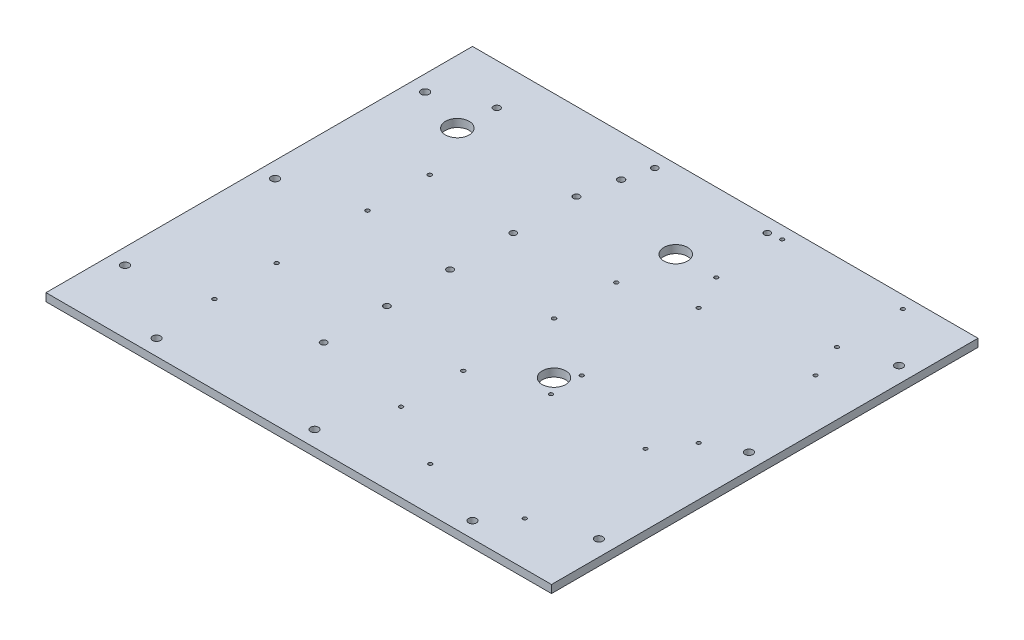
from build123d import *

# Parameters (mm, degrees)
SKETCH1_W           = 406.4
SKETCH1_H           = 342.9
BOSS_EXTRUDE1_DEPTH = 6.35
SKETCH3_R           = 3.175
CUT_EXTRUDE1_DEPTH  = 532.772218624
SKETCH4_R           = 9.525
SKETCH4_R_2         = 1.5875
SKETCH4_R_3         = 2.5
SKETCH4_R_4         = 2.667
SKETCH4_R_5         = 2.54
SKETCH4_R_6         = 1.5
CUT_EXTRUDE2_DEPTH  = 532.772218624


with BuildPart() as part:
    # Sketch1 → Boss-Extrude1 (new body)
    with BuildSketch(Plane(origin=(0, 0, 0), x_dir=(1, 0, 0), z_dir=(0, 1, 0))):
        with Locations((203.2, 171.45)):
            Rectangle(SKETCH1_W, SKETCH1_H)
    extrude(amount=BOSS_EXTRUDE1_DEPTH)

    # Sketch3 → Cut-Extrude1 (cut, through all)
    with BuildSketch(Plane(origin=(0, 6.35, 0), x_dir=(1, 0, 0), z_dir=(0, 1, 0))):
        with Locations((203.2, 12.7)):
            Circle(SKETCH3_R)
        with Locations((330.2, 12.7)):
            Circle(SKETCH3_R)
        with Locations((76.2, 12.7)):
            Circle(SKETCH3_R)
        with Locations((12.7, 171.45)):
            Circle(SKETCH3_R)
        with Locations((393.7, 171.45)):
            Circle(SKETCH3_R)
        with Locations((12.7, 292.1)):
            Circle(SKETCH3_R)
        with Locations((12.7, 50.8)):
            Circle(SKETCH3_R)
        with Locations((393.7, 50.8)):
            Circle(SKETCH3_R)
        with Locations((393.7, 292.1)):
            Circle(SKETCH3_R)
    extrude(amount=-CUT_EXTRUDE1_DEPTH, mode=Mode.SUBTRACT)

    # Sketch4 → Cut-Extrude2 (cut, through all)
    with BuildSketch(Plane(origin=(0, 6.35, 0), x_dir=(1, 0, 0), z_dir=(0, 1, 0))):
        with Locations((226.4, 279.9)):
            Circle(SKETCH4_R)
        with Locations((50.8, 279.9)):
            Circle(SKETCH4_R)
        with Locations((222.1748, 63.265)):
            Circle(SKETCH4_R_2)
        with Locations((222.1748, 113.265)):
            Circle(SKETCH4_R_2)
        with Locations((72.1748, 113.265)):
            Circle(SKETCH4_R_2)
        with Locations((72.1748, 63.265)):
            Circle(SKETCH4_R_2)
        with Locations((72.1748, 186.295)):
            Circle(SKETCH4_R_2)
        with Locations((72.1748, 236.295)):
            Circle(SKETCH4_R_2)
        with Locations((222.1748, 236.295)):
            Circle(SKETCH4_R_2)
        with Locations((222.1748, 186.295)):
            Circle(SKETCH4_R_2)
        with Locations((248.4501, 331.47)):
            Circle(SKETCH4_R_3)
        with Locations((157.9499, 331.47)):
            Circle(SKETCH4_R_3)
        with Locations((52.5398, 309.88)):
            Circle(SKETCH4_R_4)
        with Locations((152.5398, 309.88)):
            Circle(SKETCH4_R_4)
        with Locations((146.3548, 178.4985)):
            Circle(SKETCH4_R_5)
        with Locations((146.3548, 127.6985)):
            Circle(SKETCH4_R_5)
        with Locations((146.3548, 76.8985)):
            Circle(SKETCH4_R_5)
        with Locations((146.3548, 280.0985)):
            Circle(SKETCH4_R_5)
        with Locations((146.3548, 229.2985)):
            Circle(SKETCH4_R_5)
        with Locations((355.833, 333.05)):
            Circle(SKETCH4_R_6)
        with Locations((258.833, 333.05)):
            Circle(SKETCH4_R_6)
        with Locations((355.833, 280.05)):
            Circle(SKETCH4_R_6)
        with Locations((258.833, 280.05)):
            Circle(SKETCH4_R_6)
        with Locations((366.9502, 251.78)):
            Circle(SKETCH4_R_6)
        with Locations((272.9502, 251.78)):
            Circle(SKETCH4_R_6)
        with Locations((366.9502, 157.78)):
            Circle(SKETCH4_R_6)
        with Locations((272.9502, 157.78)):
            Circle(SKETCH4_R_6)
        with Locations((349.7002, 35.25)):
            Circle(SKETCH4_R_6)
        with Locations((349.7002, 132.25)):
            Circle(SKETCH4_R_6)
        with Locations((273.7002, 132.25)):
            Circle(SKETCH4_R_6)
        with Locations((273.7002, 35.25)):
            Circle(SKETCH4_R_6)
        with Locations((263.4, 145)):
            Circle(SKETCH4_R)
    extrude(amount=-CUT_EXTRUDE2_DEPTH, mode=Mode.SUBTRACT)


solid = part.part
